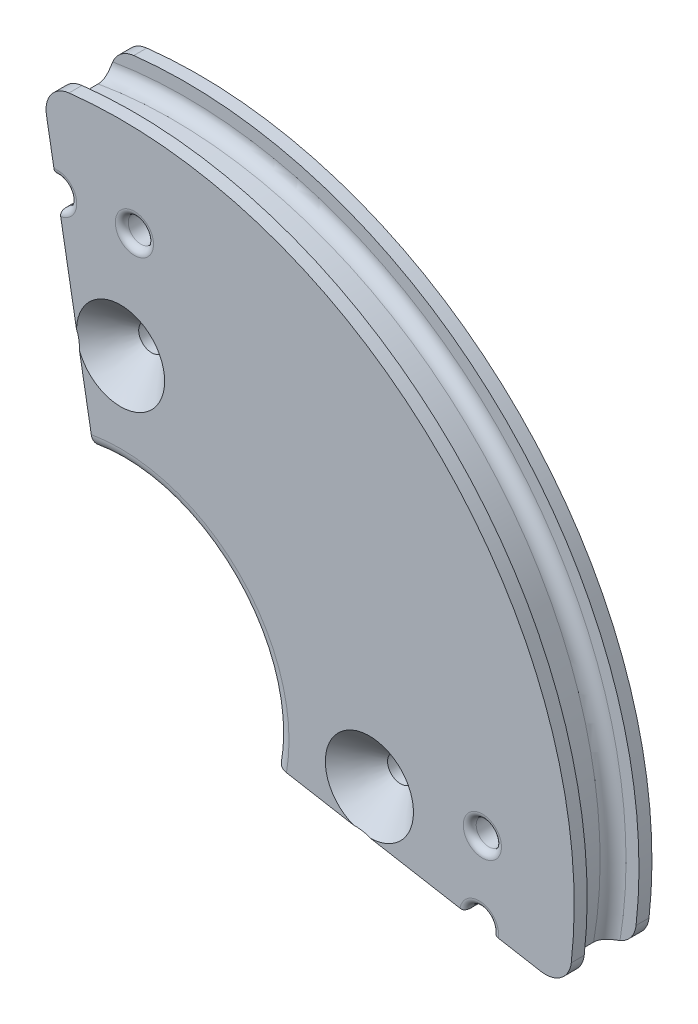
from build123d import *

# Parameters (mm, degrees)
SKETCH1_R               = 17
SKETCH1_R_2             = 0.5
SKETCH1_R_3             = 6
BOSS_EXTRUDE1_DEPTH     = 1.5
SKETCH7_W               = 0.5
SKETCH7_H               = 0.5
CUT_EXTRUDE1_DEPTH      = 25.794152536
CUT_EXTRUDE1_DEPTH_BACK = 25.794152536
CUT_EXTRUDE2_DEPTH      = 25.929901725
CUT_EXTRUDE2_DEPTH_BACK = 25.929901725
SKETCH5_R               = 0.5
SKETCH5_R_2             = 0.48729794
FILLET1_R               = 0.5
CHAMFER1_SIZE           = 1.2
FILLET2_R               = 1
FILLET3_R               = 0.25


with BuildPart() as part:
    # Sketch1 → Boss-Extrude1 (new, symmetric)
    with BuildSketch(Plane.XY):
        Circle(SKETCH1_R)
        with Locations((9.6, 0)):
            Circle(SKETCH1_R_2, mode=Mode.SUBTRACT)
        Circle(SKETCH1_R_3, mode=Mode.SUBTRACT)
        with Locations((0, -9.6)):
            Circle(SKETCH1_R_2, mode=Mode.SUBTRACT)
        with Locations((-9.6, 0)):
            Circle(SKETCH1_R_2, mode=Mode.SUBTRACT)
        with Locations((0, 9.6)):
            Circle(SKETCH1_R_2, mode=Mode.SUBTRACT)
    extrude(amount=BOSS_EXTRUDE1_DEPTH, both=True)

    # Sketch2 → Cut-Revolve1 (revolve, cut)
    with BuildSketch(Plane(origin=(0, 0, 0), x_dir=(1, 0, 0), z_dir=(0, 1, 0)), mode=Mode.PRIVATE) as cut_revolve1_sk:
        with BuildLine():
            Line((-16.5, -0.5), (-16.5, 0.5))
            ThreePointArc((-16.5, 0.5), (-16.646446609, 0.853553391), (-17, 1))
            Line((-17, 1), (-17, -1))
            ThreePointArc((-17, -1), (-16.646446609, -0.853553391), (-16.5, -0.5))
        make_face()
    revolve(cut_revolve1_sk.sketch.rotate(Axis((0, 0, 0), (0, 0, -1)), 180), axis=Axis((0, 0, 0), (0, 0, -1)), mode=Mode.SUBTRACT)

    # Sketch7 → Revolve1 (revolve)
    with BuildSketch(Plane(origin=(0, 0, 0), x_dir=(1, 0, 0), z_dir=(0, 1, 0))):
        with Locations((17.25, 1.25)):
            Rectangle(SKETCH7_W, SKETCH7_H)
        with Locations((17.25, -1.25)):
            Rectangle(SKETCH7_W, SKETCH7_H)
    revolve(axis=Axis((0, 0, 0), (0, 0, -1)))

    # Sketch4 → Cut-Extrude1 (cut, two sides: drawn at the far end of the back side and taken through both)
    with BuildSketch(Plane.XY.offset(-CUT_EXTRUDE1_DEPTH_BACK)):
        Polygon((-3.30899291, 18.766231333), (0, 0), (18.766231333, -3.30899291), (18.766231333, -21.784688157), (-24.932091475, -21.784688157), (-24.932091475, 18.766231333), align=None)
    extrude(amount=CUT_EXTRUDE1_DEPTH + CUT_EXTRUDE1_DEPTH_BACK, mode=Mode.SUBTRACT)

    # Sketch5 → Cut-Extrude2 (cut, two sides: drawn at the far end of the back side and taken through both)
    with BuildSketch(Plane.XY.offset(1.5).offset(-CUT_EXTRUDE2_DEPTH_BACK)):
        with Locations((-2.439480379, 13.834980723)):
            Circle(SKETCH5_R)
        with Locations((0.534729508, 13.957250241)):
            Circle(SKETCH5_R_2)
        with Locations((13.957250241, 0.534729508)):
            Circle(SKETCH5_R_2)
        with Locations((13.834980723, -2.439480379)):
            Circle(SKETCH5_R)
    extrude(amount=CUT_EXTRUDE2_DEPTH + CUT_EXTRUDE2_DEPTH_BACK, mode=Mode.SUBTRACT)

    # Fillet1
    fillet1_edges = [part.edges().sort_by_distance(p)[0] for p in [
        (4.242640687, 4.242640687, 1.5),
        (4.242640687, 4.242640687, -1.5),
    ]]
    fillet(fillet1_edges, radius=FILLET1_R)

    # Chamfer1
    # the kernel refuses this chamfer: 1.2 mm, written as the material it takes off along each edge
    with BuildSketch(Plane(origin=(9.6, 0, 1.5), x_dir=(1, 0, 0), z_dir=(0, -1, 0))) as chamfer1_piece_1:
        Polygon((0.5 + CHAMFER1_SIZE, 0), (0.5, -CHAMFER1_SIZE), (0.5, 0), align=None)
    revolve(axis=Axis((9.6, 0, 1.5), (0, 0, 1)), mode=Mode.SUBTRACT)
    with BuildSketch(Plane(origin=(0, 9.6, 1.5), x_dir=(1, 0, 0), z_dir=(0, -1, 0))) as chamfer1_piece_2:
        Polygon((0.5 + CHAMFER1_SIZE, 0), (0.5, -CHAMFER1_SIZE), (0.5, 0), align=None)
    revolve(axis=Axis((0, 9.6, 1.5), (0, 0, 1)), mode=Mode.SUBTRACT)

    # Fillet2
    # the kernel refuses this fillet: 1 mm, written as the material it takes off along each edge
    with BuildSketch(Plane(origin=(17.234135678, -3.038843109, 4.15273452), x_dir=(0.1437119745897139, 0.9896195573853244, 0), z_dir=(0, 0, -1))) as fillet2_piece_1:
        with BuildLine():
            CenterArc((1.030776842, -0.999540335), FILLET2_R, 88.262699603, 93.474600793)
            Line((0.031236507, -1.029857301), (0, 0))
            ThreePointArc((0, 0), (0.530546904, 0.008044135), (1.061093808, 0))
        make_face()
    extrude(amount=5.805469041, mode=Mode.SUBTRACT)
    with BuildSketch(Plane(origin=(-3.038843109, 17.234135678, -4.15273452), x_dir=(0.17364817766692695, -0.9848077530122086, 0), z_dir=(0, 0, 1))) as fillet2_piece_2:
        with BuildLine():
            CenterArc((1.030330908, 1), FILLET2_R, 176.525399207, 93.474600793)
            ThreePointArc((0.032169145, 1.060606061), (0.008044135, 0.530546904), (0, 0))
            Line((0, 0), (1.030330908, 0))
        make_face()
    extrude(amount=5.805469041, mode=Mode.SUBTRACT)

    # Fillet3
    fillet3_edges = [part.edges().sort_by_distance(p)[0] for p in [
        (13.921804812, -1.947076503, -1.5),
        (13.921804812, -1.947076503, 1.5),
        (14.3273846, -2.526304468, 0),
        (13.342576847, -2.35265629, 0),
        (-2.35265629, 13.342576847, 0),
        (-2.526304468, 14.3273846, 0),
        (-1.947076503, 13.921804812, -1.5),
        (-1.947076503, 13.921804812, 1.5),
        (0.047431568, 13.957250241, 1.5),
        (0.047431568, 13.957250241, -1.5),
        (13.469952302, 0.534729508, 1.5),
        (13.469952302, 0.534729508, -1.5),
    ]]
    fillet(fillet3_edges, radius=FILLET3_R)


solid = part.part
